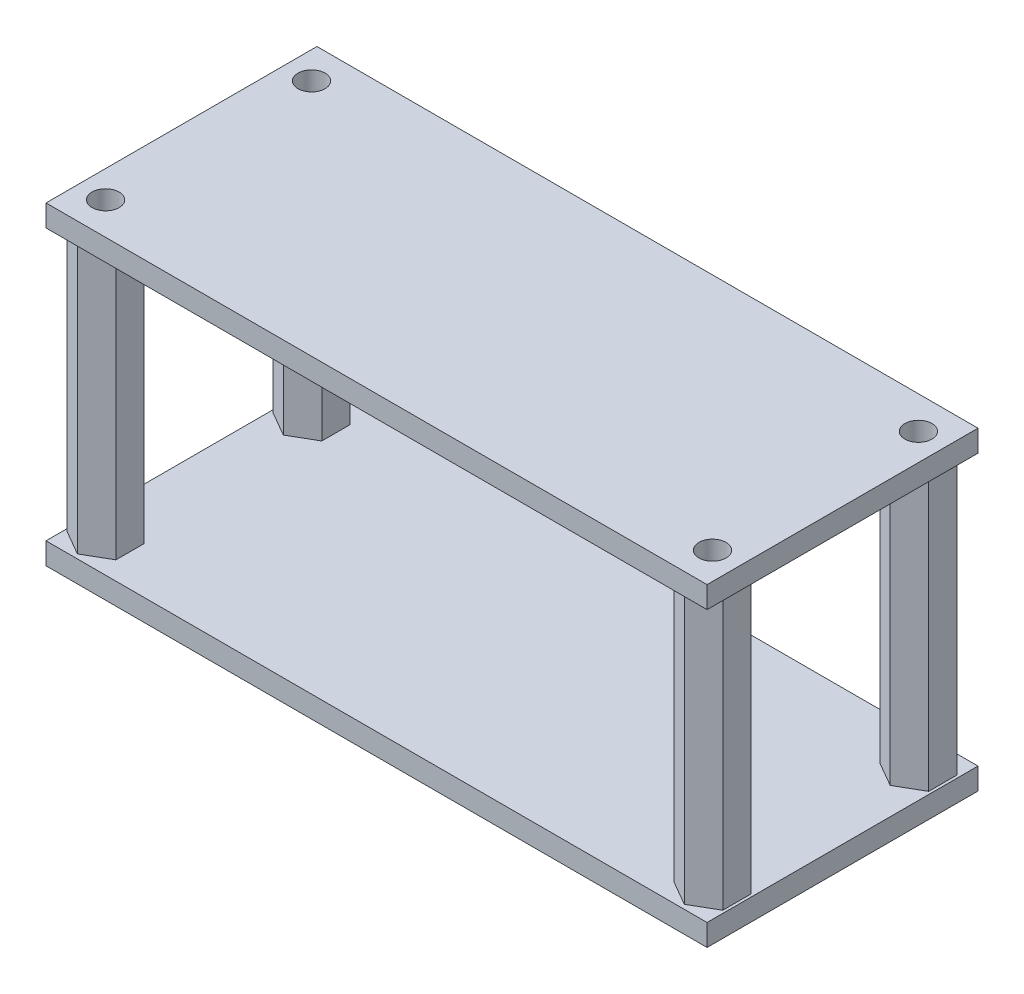
from build123d import *

# Parameters (mm, degrees)
SKETCH_1_W          = 61
SKETCH_1_H          = 25
EXTRUDE_1_DEPTH     = 2
SKETCH_2_R          = 1.25
CUT_EXTRUDE_1_DEPTH = 52
SKETCH_3_R          = 1.25
EXTRUDE_2_DEPTH     = 25
EXTRUDE_2_2_DEPTH   = 25
EXTRUDE_2_3_DEPTH   = 25
EXTRUDE_2_4_DEPTH   = 25


with BuildPart() as part:
    # 草图1 → 凸台-拉伸1 (new body)
    with BuildSketch(Plane(origin=(0, 0, 0), x_dir=(1, 0, 0), z_dir=(0, 1, 0))):
        Rectangle(SKETCH_1_W, SKETCH_1_H)
    extrude(amount=EXTRUDE_1_DEPTH)

    # 草图2 → 切除-拉伸1 (cut)
    with BuildSketch(Plane(origin=(0, 2, 0), x_dir=(1, 0, 0), z_dir=(0, 1, 0))):
        with Locations((-28, 9.5)):
            Circle(SKETCH_2_R)
        with Locations((-28, -9.5)):
            Circle(SKETCH_2_R)
        with Locations((28, 9.5)):
            Circle(SKETCH_2_R)
        with Locations((28, -9.5)):
            Circle(SKETCH_2_R)
    extrude(amount=-CUT_EXTRUDE_1_DEPTH, mode=Mode.SUBTRACT)


with BuildPart() as body_2:
    # 草图3 → 凸台-拉伸2 (new body)
    with BuildSketch(Plane(origin=(0, 2, 0), x_dir=(1, 0, 0), z_dir=(0, 1, 0))):
        Polygon((-25.75, 10.799038106), (-28, 12.098076211), (-30.25, 10.799038106), (-30.25, 8.200961894), (-28, 6.901923789), (-25.75, 8.200961894), align=None)
        with Locations((-28, 9.5)):
            Circle(SKETCH_3_R, mode=Mode.SUBTRACT)
    extrude(amount=EXTRUDE_2_DEPTH)


with BuildPart() as body_3:
    # 草图3 → Extrude 2 2 (new body)
    with BuildSketch(Plane(origin=(0, 2, 0), x_dir=(1, 0, 0), z_dir=(0, 1, 0))):
        Polygon((25.75, 8.200961894), (25.75, 10.799038106), (28, 12.098076211), (30.25, 10.799038106), (30.25, 8.200961894), (28, 6.901923789), align=None)
        with Locations((28, 9.5)):
            Circle(SKETCH_3_R, mode=Mode.SUBTRACT)
    extrude(amount=EXTRUDE_2_2_DEPTH)


with BuildPart() as body_4:
    # 草图3 → Extrude 2 3 (new body)
    with BuildSketch(Plane(origin=(0, 2, 0), x_dir=(1, 0, 0), z_dir=(0, 1, 0))):
        Polygon((25.75, -10.799038106), (28, -12.098076211), (30.25, -10.799038106), (30.25, -8.200961894), (28, -6.901923789), (25.75, -8.200961894), align=None)
        with Locations((28, -9.5)):
            Circle(SKETCH_3_R, mode=Mode.SUBTRACT)
    extrude(amount=EXTRUDE_2_3_DEPTH)


with BuildPart() as body_5:
    # 草图3 → Extrude 2 4 (new body)
    with BuildSketch(Plane(origin=(0, 2, 0), x_dir=(1, 0, 0), z_dir=(0, 1, 0))):
        Polygon((-25.75, -8.200961894), (-25.75, -10.799038106), (-28, -12.098076211), (-30.25, -10.799038106), (-30.25, -8.200961894), (-28, -6.901923789), align=None)
        with Locations((-28, -9.5)):
            Circle(SKETCH_3_R, mode=Mode.SUBTRACT)
    extrude(amount=EXTRUDE_2_4_DEPTH)


with BuildPart() as body_6:
    # Move Body 1: copy of part
    add(part.part.moved(Location((0, 27, 0))))


solid = Compound([part.part, body_2.part, body_3.part, body_4.part, body_5.part, body_6.part])
